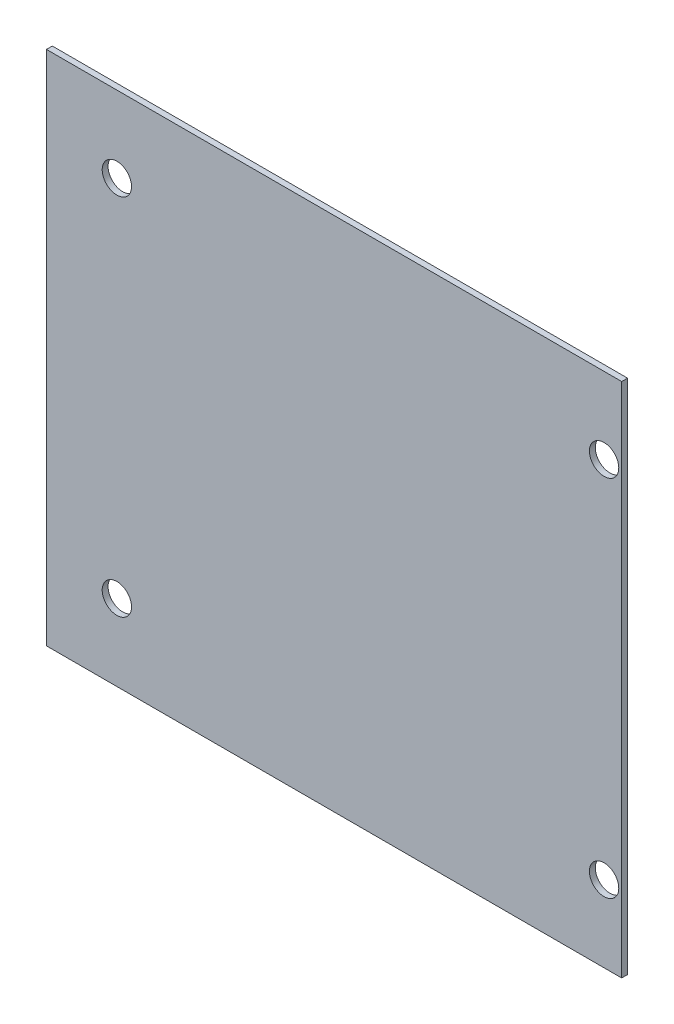
from build123d import *

# Parameters (mm, degrees)
SKETCH1_W           = 98
SKETCH1_H           = 88
SKETCH1_R           = 2.5
BOSS_EXTRUDE1_DEPTH = 1


with BuildPart() as part:
    # Sketch1 → Boss-Extrude1 (new body)
    with BuildSketch(Plane.XY):
        Rectangle(SKETCH1_W, SKETCH1_H)
        with Locations((46, -31)):
            Circle(SKETCH1_R, mode=Mode.SUBTRACT)
        with Locations((46, 31)):
            Circle(SKETCH1_R, mode=Mode.SUBTRACT)
        with Locations((-37, 31)):
            Circle(SKETCH1_R, mode=Mode.SUBTRACT)
        with Locations((-37, -31)):
            Circle(SKETCH1_R, mode=Mode.SUBTRACT)
    extrude(amount=BOSS_EXTRUDE1_DEPTH)


solid = part.part
